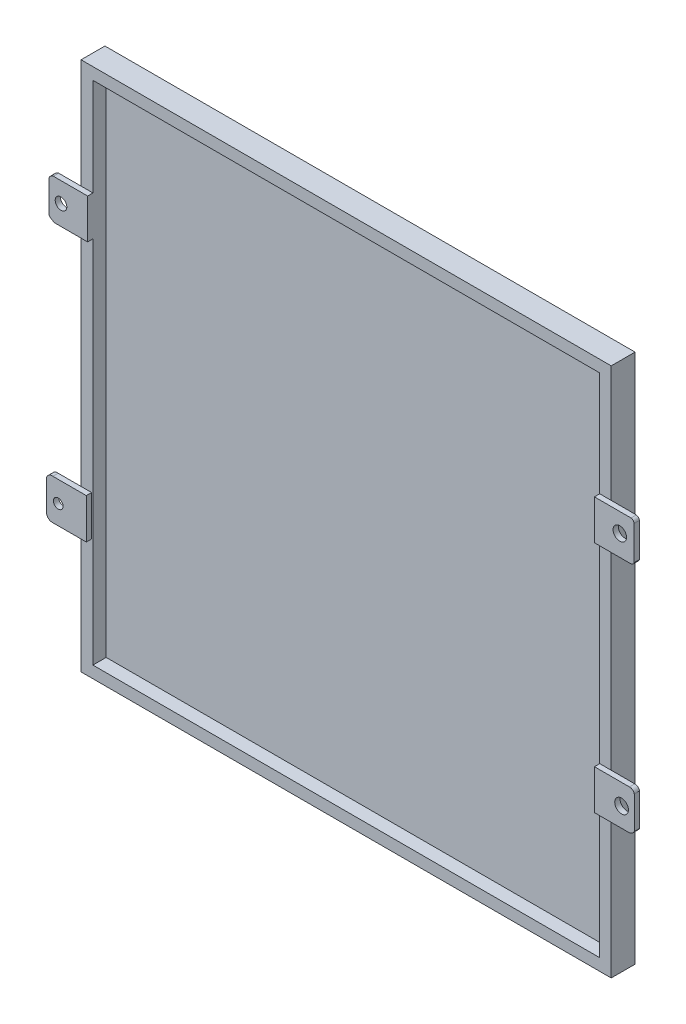
from build123d import *

# Parameters (mm, degrees)
SKETCH1_W           = 100
SKETCH1_H           = 100
BOSS_EXTRUDE3_DEPTH = 2
SKETCH2_W           = 100
SKETCH2_H           = 100
SKETCH2_W_2         = 95.53089136
SKETCH2_H_2         = 95.53089136
BOSS_EXTRUDE4_DEPTH = 2.5
BOSS_EXTRUDE6_DEPTH = 1
BOSS_EXTRUDE7_DEPTH = 1
SKETCH9_R           = 0.910901034
CUT_EXTRUDE6_DEPTH  = 1
SKETCH10_R          = 1.096992811
CUT_EXTRUDE7_DEPTH  = 1
SKETCH11_R          = 1.291571791
CUT_EXTRUDE8_DEPTH  = 1
SKETCH12_R          = 1.26967578
CUT_EXTRUDE9_DEPTH  = 1


with BuildPart() as part:
    # Sketch1 → Boss-Extrude3 (new body)
    with BuildSketch(Plane.XY):
        Rectangle(SKETCH1_W, SKETCH1_H)
    extrude(amount=BOSS_EXTRUDE3_DEPTH)

    # Sketch2 → Boss-Extrude4 (add)
    with BuildSketch(Plane.XY.offset(2)):
        Rectangle(SKETCH2_W, SKETCH2_H)
        Rectangle(SKETCH2_W_2, SKETCH2_H_2, mode=Mode.SUBTRACT)
    extrude(amount=BOSS_EXTRUDE4_DEPTH)

    # Sketch3 → Boss-Extrude6 (add)
    with BuildSketch(Plane.XY.offset(4.5)):
        with BuildLine():
            Line((-48.013645553, -27.289461537), (-54.546283847, -27.289461537))
            ThreePointArc((-54.546283847, -27.289461537), (-55.211217174, -26.960032694), (-55.532619996, -26.291182998))
            Line((-55.532619996, -26.291182998), (-55.532619996, -20.805956044))
            ThreePointArc((-55.532619996, -20.805956044), (-55.184106994, -19.977079681), (-54.328656474, -19.700128883))
            Line((-54.328656474, -19.700128883), (-48.013645553, -19.700128883))
            Line((-48.013645553, -19.700128883), (-48.013645553, -27.289461537))
        make_face()
        with BuildLine():
            Line((47.839503963, -23.563018867), (54.299562904, -23.563018867))
            ThreePointArc((54.299562904, -23.563018867), (54.911448643, -23.367601426), (55.35048858, -22.898734634))
            Line((55.35048858, -22.898734634), (55.35048858, -16.760155882))
            ThreePointArc((55.35048858, -16.760155882), (55.024151653, -16.240470674), (54.436717093, -16.063018867))
            Line((54.436717093, -16.063018867), (47.839503963, -16.063018867))
            Line((47.839503963, -16.063018867), (47.839503963, -23.563018867))
        make_face()
        with BuildLine():
            Line((47.839503963, 20.518885766), (54.613619996, 20.518885766))
            ThreePointArc((54.613619996, 20.518885766), (55.061066906, 20.648389134), (55.335095154, 21.025069874))
            Line((55.335095154, 21.025069874), (55.335095154, 27.431733548))
            ThreePointArc((55.335095154, 27.431733548), (55.133810813, 27.817601425), (54.747942936, 28.018885766))
            Line((54.747942936, 28.018885766), (47.839503963, 28.018885766))
            Line((47.839503963, 28.018885766), (47.839503963, 20.518885766))
        make_face()
    extrude(amount=BOSS_EXTRUDE6_DEPTH)

    # Sketch8 → Boss-Extrude7 (add)
    with BuildSketch(Plane.XY.offset(4.5)):
        with BuildLine():
            ThreePointArc((-55.073635388, 22.67348428), (-54.539217969, 22.143045191), (-53.839952274, 21.863769174))
            Line((-53.839952274, 21.863769174), (-47.76544568, 21.863769174))
            Line((-47.76544568, 21.863769174), (-47.76544568, 29.363769174))
            Line((-47.76544568, 29.363769174), (-54.227226945, 29.363769174))
            ThreePointArc((-54.227226945, 29.363769174), (-54.831835784, 29.045974861), (-55.073635388, 28.407165011))
            Line((-55.073635388, 28.407165011), (-55.073635388, 22.67348428))
        make_face()
    extrude(amount=BOSS_EXTRUDE7_DEPTH)

    # Sketch9 → Cut-Extrude6 (cut)
    with BuildSketch(Plane.XY.offset(5.5)):
        with Locations((-53.309433702, -23.647341324)):
            Circle(SKETCH9_R)
    extrude(amount=-CUT_EXTRUDE6_DEPTH, mode=Mode.SUBTRACT)

    # Sketch10 → Cut-Extrude7 (cut)
    with BuildSketch(Plane.XY.offset(5.5)):
        with Locations((-52.784195536, 25.6056192)):
            Circle(SKETCH10_R)
    extrude(amount=-CUT_EXTRUDE7_DEPTH, mode=Mode.SUBTRACT)

    # Sketch11 → Cut-Extrude8 (cut)
    with BuildSketch(Plane.XY.offset(5.5)):
        with Locations((52.957577763, -19.925166923)):
            Circle(SKETCH11_R)
    extrude(amount=-CUT_EXTRUDE8_DEPTH, mode=Mode.SUBTRACT)

    # Sketch12 → Cut-Extrude9 (cut)
    with BuildSketch(Plane.XY.offset(5.5)):
        with Locations((52.615368967, 24.424618713)):
            Circle(SKETCH12_R)
    extrude(amount=-CUT_EXTRUDE9_DEPTH, mode=Mode.SUBTRACT)


solid = part.part
